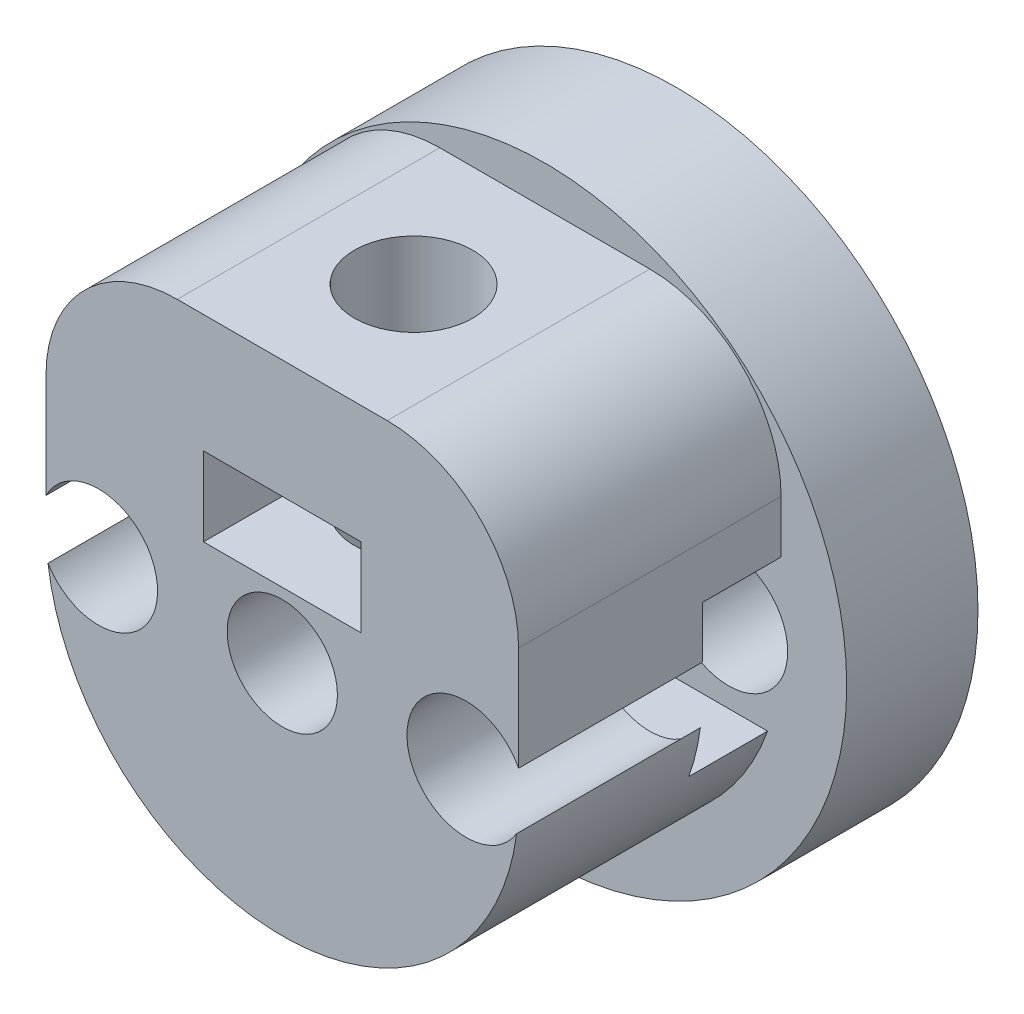
from build123d import *

# Parameters (mm, degrees)
SKETCH1_R           = 11.5
BOSS_EXTRUDE1_DEPTH = 5
SKETCH2_R           = 2.25
CUT_EXTRUDE1_DEPTH  = 18.014699527
CIRPATTERN1_COUNT   = 4
SKETCH3_R           = 9
BOSS_EXTRUDE2_DEPTH = 10
SKETCH4_R           = 2.1
CUT_EXTRUDE2_DEPTH  = 23.12464689
BOSS_EXTRUDE3_REACH = 30.627
SKETCH5_W           = 18
SKETCH5_H           = 10
SKETCH6_R           = 2.25
CUT_EXTRUDE3_DEPTH  = 10
CHAMFER2_SIZE       = 1
FILLET1_R           = 5
CUT_EXTRUDE4_DEPTH  = 20.091883144
SKETCH8_W           = 6
SKETCH8_H           = 3
CUT_EXTRUDE7_DEPTH  = 10
SKETCH9_W           = 3
SKETCH9_H           = 6
CUT_EXTRUDE8_DEPTH  = 6


with BuildPart() as part:
    # Sketch1 → Boss-Extrude1 (new body)
    with BuildSketch(Plane.XY):
        Circle(SKETCH1_R)
    extrude(amount=BOSS_EXTRUDE1_DEPTH)

    # Sketch2 → Cut-Extrude1 (cut, through all)
    with BuildSketch(Plane.XY.offset(5)):
        with Locations((0, 7)):
            Circle(SKETCH2_R)
    cut_extrude1 = extrude(amount=-CUT_EXTRUDE1_DEPTH, mode=Mode.SUBTRACT)

    # CirPattern1: Cut-Extrude1 ×4 about axis
    cirpattern1_axis = Axis((0, 0, 0), (0, 0, 1))
    for i in range(1, CIRPATTERN1_COUNT):
        add(cut_extrude1.rotate(cirpattern1_axis, i * 360 / CIRPATTERN1_COUNT), mode=Mode.SUBTRACT)

    # Sketch3 → Boss-Extrude2 (add)
    with BuildSketch(Plane.XY.offset(5)):
        with Locations(Location((0, 0, 0), (0, 0, 172.554009398))):
            Circle(SKETCH3_R)
    extrude(amount=BOSS_EXTRUDE2_DEPTH)

    # Sketch4 → Cut-Extrude2 (cut, through all)
    with BuildSketch(Plane.XY.offset(15)):
        Circle(SKETCH4_R)
    extrude(amount=-CUT_EXTRUDE2_DEPTH, mode=Mode.SUBTRACT)

    # Sketch5 → Boss-Extrude3 (add, up to next)
    with BuildSketch(Plane(origin=(0, 10, 0), x_dir=(1, 0, 0), z_dir=(0, 1, 0)), mode=Mode.PRIVATE) as boss_extrude3_sk1:
        with Locations((0, -10)):
            Rectangle(SKETCH5_W, SKETCH5_H)
    boss_extrude3_tool1 = extrude(boss_extrude3_sk1.sketch, amount=-BOSS_EXTRUDE3_REACH, mode=Mode.PRIVATE) - part.part
    add(boss_extrude3_tool1.solids().sort_by_distance((0, 10, 10))[0])

    # Sketch6 → Cut-Extrude3 (cut)
    with BuildSketch(Plane(origin=(0, 10, 0), x_dir=(1, 0, 0), z_dir=(0, 1, 0))):
        with Locations(Location((0, -10, 0), (0, 0, 270))):
            Circle(SKETCH6_R)
    extrude(amount=-CUT_EXTRUDE3_DEPTH, mode=Mode.SUBTRACT)

    # Chamfer2
    chamfer2_edges = [part.edges().sort_by_distance(p)[0] for p in [
        (-7, -2.25, 0),
        (2.25, -7, 0),
        (7, 2.25, 0),
        (-2.25, 7, 0),
    ]]
    chamfer(chamfer2_edges, length=CHAMFER2_SIZE)

    # Fillet1
    # the kernel refuses this fillet: 5 mm, written as the material it takes off along each edge
    with BuildSketch(Plane(origin=(-9, 10, 27.5), x_dir=(0, -1, 0), z_dir=(0, 0, -1)), Plane(origin=(9, 10, 5), x_dir=(0, -1, 0), z_dir=(0, 0, 1))) as fillet1_piece_1:
        with BuildLine():
            CenterArc((FILLET1_R, -FILLET1_R), FILLET1_R, 90, 90)
            Line((0, -FILLET1_R), (0, 0))
            Line((0, 0), (FILLET1_R, 0))
        make_face()
    extrude(amount=22.5, mode=Mode.SUBTRACT)

    # Sketch7 → Cut-Extrude4 (cut, through all)
    with BuildSketch(Plane(origin=(0, 0, 5), x_dir=(-1, 0, 0), z_dir=(0, 0, -1))):
        with BuildLine():
            Line((-9, 1.030776406), (-9, 0))
            ThreePointArc((-9, 0), (-8.981006744, -0.584395292), (-8.924107143, -1.166324013))
            ThreePointArc((-8.924107143, -1.166324013), (-4.751341115, 0.077673804), (-9, 1.030776406))
        make_face()
        with BuildLine():
            Line((9, 0), (9, 1.030776406))
            ThreePointArc((9, 1.030776406), (4.751341115, 0.077673804), (8.924107143, -1.166324013))
            ThreePointArc((8.924107143, -1.166324013), (8.981006744, -0.584395292), (9, 0))
        make_face()
    extrude(amount=-CUT_EXTRUDE4_DEPTH, mode=Mode.SUBTRACT)

    # Sketch8 → Cut-Extrude7 (cut)
    with BuildSketch(Plane.XY.offset(15)):
        with Locations((0, 4)):
            Rectangle(SKETCH8_W, SKETCH8_H)
    extrude(amount=-CUT_EXTRUDE7_DEPTH, mode=Mode.SUBTRACT)

    # Sketch9 → Cut-Extrude8 (cut)
    with BuildSketch(Plane(origin=(9, 0, 0), x_dir=(0, 0, -1), z_dir=(1, 0, 0))):
        with Locations((-6.5, 0)):
            Rectangle(SKETCH9_W, SKETCH9_H)
    cut_extrude8 = extrude(amount=-CUT_EXTRUDE8_DEPTH, mode=Mode.SUBTRACT)

    # Mirror1: Cut-Extrude8 across plane
    add(cut_extrude8.mirror(Plane(origin=(0, 0, 0), x_dir=(0, 0, 1), z_dir=(1, 0, 0))), mode=Mode.SUBTRACT)


solid = part.part
